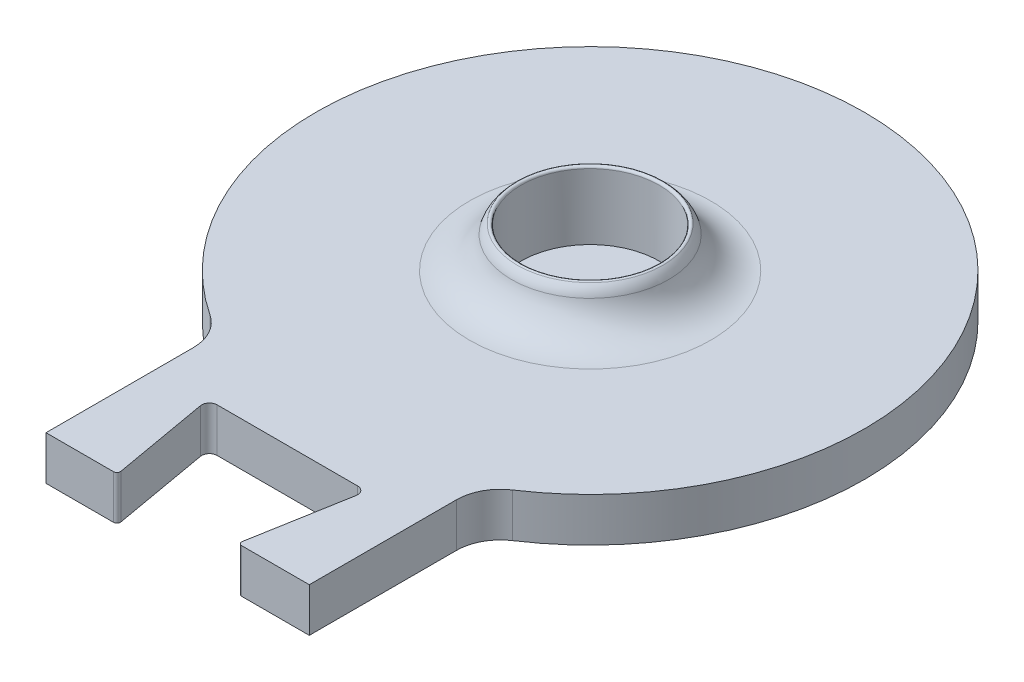
from build123d import *

# Parameters (mm, degrees)
BOSS_EXTRUDE1_DEPTH = 2
SKETCH2_R           = 12.5
SKETCH2_R_2         = 3
BOSS_EXTRUDE2_DEPTH = 2
SKETCH4_W           = 12
SKETCH4_H           = 0.2
CUT_EXTRUDE1_DEPTH  = 4
FILLET3_R           = 0.35
FILLET4_R           = 0.15
FILLET6_R           = 2
SKETCH6_R           = 3.5
BOSS_EXTRUDE5_DEPTH = 2
SKETCH7_R           = 3.15
CUT_EXTRUDE3_DEPTH  = 3.2
FILLET7_R           = 2
FILLET8_R           = 1
FILLET9_R           = 0.1
SKETCH8_R           = 0.3
CUT_EXTRUDE4_DEPTH  = 23.787574965


# Some blends are built 0.0001 mm under size
with BuildPart() as part:
    # Sketch1 → Boss-Extrude1 (new body)
    with BuildSketch(Plane(origin=(0, 0, 0), x_dir=(1, 0, 0), z_dir=(0, 1, 0))):
        Polygon((-6, 6), (-6, -13.291502622), (-6, -19), (-2.70227506, -19), (-3.619175359, -13.8), (0, -13.8), (3.619175359, -13.8), (2.70227506, -19), (6, -19), (6, -13.291502622), (6, 6), align=None)
    extrude(amount=BOSS_EXTRUDE1_DEPTH)

    # Sketch2 → Boss-Extrude2 (add)
    with BuildSketch(Plane(origin=(0, 0, 0), x_dir=(1, 0, 0), z_dir=(0, 1, 0))):
        Circle(SKETCH2_R)
        Circle(SKETCH2_R_2, mode=Mode.SUBTRACT)
    extrude(amount=BOSS_EXTRUDE2_DEPTH)

    # Sketch4 → Cut-Extrude1 (cut)
    with BuildSketch(Plane(origin=(0, 2, 0), x_dir=(1, 0, 0), z_dir=(0, 1, 0))):
        with Locations((0, -18.9)):
            Rectangle(SKETCH4_W, SKETCH4_H)
    extrude(amount=-CUT_EXTRUDE1_DEPTH, mode=Mode.SUBTRACT)

    # Fillet3
    fillet3_edges = [part.edges().sort_by_distance(p)[0] for p in [
        (3.619175359, 1, 13.8),
        (-3.619175359, 1, 13.8),
    ]]
    fillet(fillet3_edges, radius=FILLET3_R)

    # Fillet4
    fillet4_edges = [part.edges().sort_by_distance(p)[0] for p in [
        (2.737540456, 1, 18.8),
        (-2.737540456, 1, 18.8),
    ]]
    fillet(fillet4_edges, radius=FILLET4_R)

    # Fillet6
    fillet6_edges = [part.edges().sort_by_distance(p)[0] for p in [
        (-6, 1, 10.9658561),
        (6, 1, 10.9658561),
    ]]
    fillet(fillet6_edges, radius=FILLET6_R)

    # Sketch6 → Boss-Extrude5 (add)
    with BuildSketch(Plane(origin=(0, 2, 0), x_dir=(1, 0, 0), z_dir=(0, 1, 0))):
        with Locations(Location((0, 0, 0), (0, 0, 270))):
            Circle(SKETCH6_R)
    extrude(amount=BOSS_EXTRUDE5_DEPTH)

    # Sketch7 → Cut-Extrude3 (cut)
    with BuildSketch(Plane(origin=(0, 4, 0), x_dir=(1, 0, 0), z_dir=(0, 1, 0))):
        with Locations(Location((0, 0, 0), (0, 0, 270))):
            Circle(SKETCH7_R)
    extrude(amount=-CUT_EXTRUDE3_DEPTH, mode=Mode.SUBTRACT)

    # Fillet7
    fillet7_edges = [part.edges().sort_by_distance(p)[0] for p in [
        (0, 2, -3.5),
    ]]
    fillet(fillet7_edges, radius=FILLET7_R - 0.0001)  # a hair under: the kernel refuses the full size

    # Fillet8
    # the kernel refuses this fillet: 1 mm, written as the material it takes off along each edge
    with BuildSketch(Plane(origin=(0, 4, 0), x_dir=(0, 0, 1), z_dir=(-1, 0, 0))) as fillet8_piece_1:
        with BuildLine():
            CenterArc((2.62284141, -0.849766921), FILLET8_R, 16.453180618, 41.733146886)
            Line((3.15, 0), (3.202715859, 0.084976692))
            ThreePointArc((3.202715859, 0.084976692), (3.325, 0.1), (3.5, 0.1))
            Line((3.5, 0.1), (3.6, 0))
            ThreePointArc((3.6, 0), (3.6, -0.0001), (3.677798058, -0.538211998))
            Line((3.677798058, -0.538211998), (3.581892908, -0.566535173))
        make_face()
    revolve(axis=Axis((0, 4, 0), (0, 1, 0)), mode=Mode.SUBTRACT)

    # Fillet9
    fillet9_edges = [part.edges().sort_by_distance(p)[0] for p in [
        (0, 4, -3.15),
    ]]
    fillet(fillet9_edges, radius=FILLET9_R)

    # Sketch8 → Cut-Extrude4 (cut, through all)
    with BuildSketch(Plane(origin=(0, 0.8, 0), x_dir=(1, 0, 0), z_dir=(0, 1, 0))):
        with Locations(Location((0, 0, 0), (0, 0, 270))):
            Circle(SKETCH8_R)
    extrude(amount=-CUT_EXTRUDE4_DEPTH, mode=Mode.SUBTRACT)


solid = part.part
